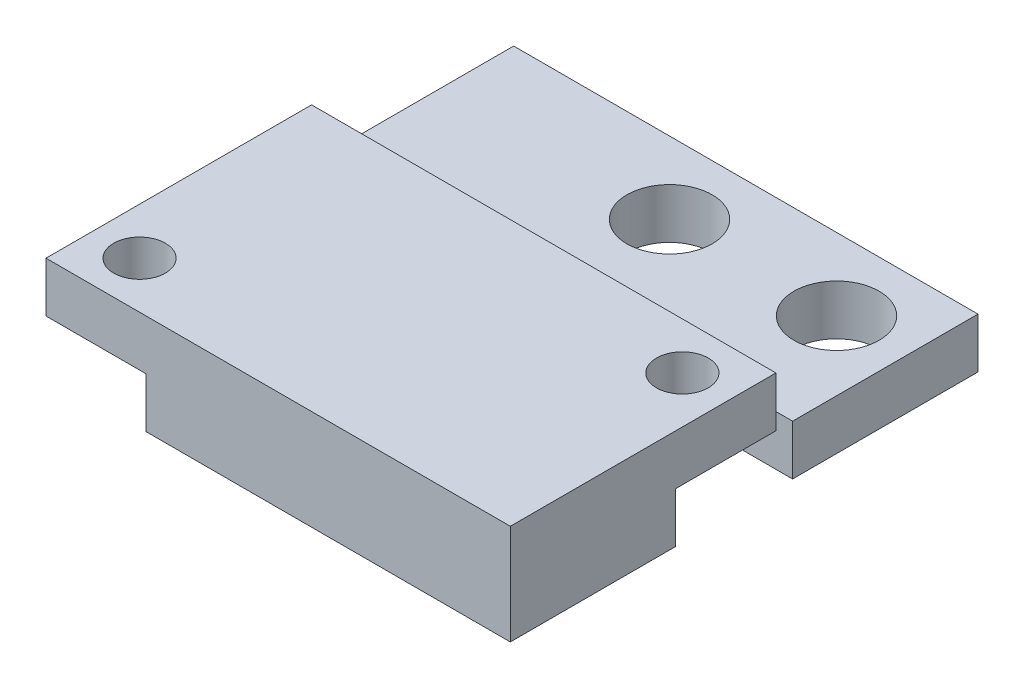
from build123d import *

# Parameters (mm, degrees)
SKETCH1_W           = 27.8
SKETCH1_H           = 28
SKETCH1_R           = 2.55
BOSS_EXTRUDE1_DEPTH = 3
SKETCH2_W           = 27.8
SKETCH2_H           = 15.9
SKETCH2_R           = 1.55
BOSS_EXTRUDE2_DEPTH = 3
SKETCH3_W           = 6
SKETCH3_H           = 6
CUT_EXTRUDE5_DEPTH  = 3
SKETCH4_W           = 6
SKETCH4_H           = 7
CUT_EXTRUDE7_DEPTH  = 3


with BuildPart() as part:
    # Sketch1 → Boss-Extrude1 (new body)
    with BuildSketch(Plane(origin=(0, 0, 0), x_dir=(1, 0, 0), z_dir=(0, 1, 0))):
        with Locations((13.9, 14)):
            Rectangle(SKETCH1_W, SKETCH1_H)
        with Locations((13.65, 23.68)):
            Circle(SKETCH1_R, mode=Mode.SUBTRACT)
        with Locations((23.65, 23.68)):
            Circle(SKETCH1_R, mode=Mode.SUBTRACT)
    extrude(amount=BOSS_EXTRUDE1_DEPTH)

    # Sketch2 → Boss-Extrude2 (add)
    with BuildSketch(Plane(origin=(0, 3, 0), x_dir=(1, 0, 0), z_dir=(0, 1, 0))):
        with Locations((13.9, 7.95)):
            Rectangle(SKETCH2_W, SKETCH2_H)
        with Locations((2.8, 2.8)):
            Circle(SKETCH2_R, mode=Mode.SUBTRACT)
        with Locations((25, 13.1)):
            Circle(SKETCH2_R, mode=Mode.SUBTRACT)
    extrude(amount=BOSS_EXTRUDE2_DEPTH)

    # Sketch3 → Cut-Extrude5 (cut)
    with BuildSketch(Plane.XZ):
        with Locations((3, -3)):
            Rectangle(SKETCH3_W, SKETCH3_H)
    extrude(amount=-CUT_EXTRUDE5_DEPTH, mode=Mode.SUBTRACT)

    # Sketch4 → Cut-Extrude7 (cut)
    with BuildSketch(Plane.XZ):
        with Locations((24.8, -13.4)):
            Rectangle(SKETCH4_W, SKETCH4_H)
    extrude(amount=-CUT_EXTRUDE7_DEPTH, mode=Mode.SUBTRACT)


solid = part.part
